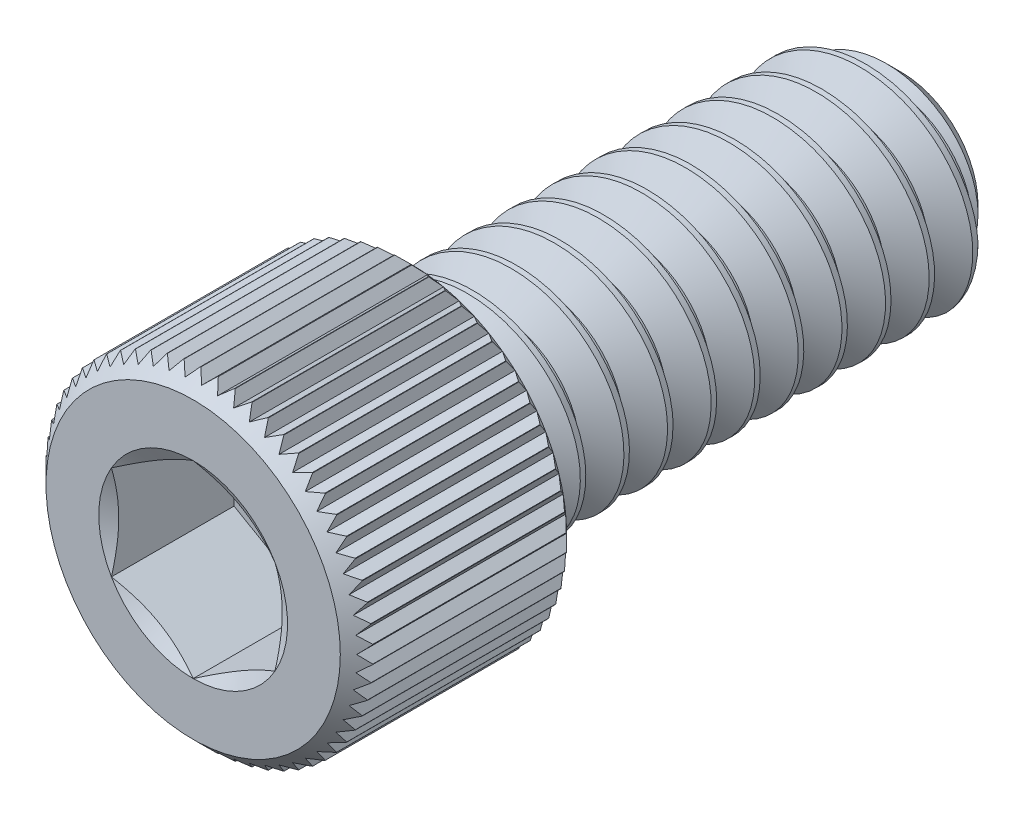
from build123d import *
from build123d.topology import SkipClean

# Parameters (mm, degrees)
CUT_EXTRUDE1_DEPTH = 3.571875
CHAMFER1_SIZE      = 0.47625
CHAMFER2_SIZE      = 0.238125
CUT_SWEEP1_PITCH   = 1.27
CUT_SWEEP1_TO      = 14.2875
CUT_EXTRUDE3_REACH = 17.795
CIRPATTERN1_COUNT  = 60


with BuildPart() as part:
    # Sketch2 → Revolve1 (revolve)
    with BuildSketch(Plane(origin=(0, 0, 0), x_dir=(0, 0, -1), z_dir=(1, 0, 0)), mode=Mode.PRIVATE) as revolve1_sk:
        Polygon((10.31875, 2.2225), (9.36625, 3.175), (-3.96875, 3.175), (-3.96875, 4.7625), (-10.31875, 4.7625), (-10.31875, 0), (10.31875, 0), align=None)
    revolve(revolve1_sk.sketch.rotate(Axis((0, 0, -10.31875), (0, 0, 1)), 90), axis=Axis((0, 0, -10.31875), (0, 0, 1)))

    # Sketch4 → Cut-Extrude1 (cut)
    with BuildSketch(Plane.XY.offset(10.31875)):
        Polygon((0, 2.749630657), (-2.38125, 1.374815329), (-2.38125, -1.374815329), (0, -2.749630657), (2.38125, -1.374815329), (2.38125, 1.374815329), align=None)
    extrude(amount=-CUT_EXTRUDE1_DEPTH, mode=Mode.SUBTRACT)

    # Cut-Extrude2 cone 1 section (through the dimple's axis) → Cut-Extrude2 (revolve, cut)
    with BuildSketch(Plane(origin=(0, 0, 10.31875), x_dir=(0, -1, 0), z_dir=(1, 0, 0))):
        Polygon((0, 0), (2.749630657, 0), (0, 1.5875), align=None)
    revolve(axis=Axis((0, 0, 10.31875), (0, 0, -1)), mode=Mode.SUBTRACT)

    # Chamfer1
    chamfer1_edges = [part.edges().sort_by_distance(p)[0] for p in [
        (4.7625, 0, 10.31875),
    ]]
    chamfer(chamfer1_edges, length=CHAMFER1_SIZE)

    # Chamfer2
    chamfer2_edges = [part.edges().sort_by_distance(p)[0] for p in [
        (4.7625, 0, 3.96875),
    ]]
    chamfer(chamfer2_edges, length=CHAMFER2_SIZE)


with BuildPart() as body_2:
    # Split1: read off the stored shape, not the designer's step
    # Split1: the piece on the far side of the plane
    add(part.part)
    split(bisect_by=Plane.XY.offset(3.96875), keep=Keep.BOTTOM)

    # Cut-Sweep1: arcs per turn and ends read off the stored shape
    # Cut-Sweep1: the profile of Sketch7 profile screwed along a right-hand helix through 12.25 turns, 8 arcs to a turn; built about Z, then put on its axis
    cut_sweep1_z = Axis((0, 0, 0), (0, 0, 1))
    cut_sweep1_corners = [(3.1753, 0, 0.000173205), (3.1753, 0, -1.111423205), (2.350110803, 0, -0.635), (2.350110803, 0, -0.47625)]
    with BuildLine(mode=Mode.PRIVATE) as cut_sweep1_profile:
        Line(cut_sweep1_corners[0], cut_sweep1_corners[1])
        Line(cut_sweep1_corners[1], cut_sweep1_corners[2])
        Line(cut_sweep1_corners[2], cut_sweep1_corners[3])
        Line(cut_sweep1_corners[3], cut_sweep1_corners[0])
    cut_sweep1_cap = Face(cut_sweep1_profile.wire())
    cut_sweep1_turn_angles = [0, 22.5, 45, 67.5, 90, 112.5, 135, 157.5, 180, 202.5, 225, 247.5, 270, 292.5, 315, 337.5, 360]
    cut_sweep1_turn_weights = [1, 0.9238795325112867, 1, 0.9238795325112867, 1, 0.9238795325112867, 1, 0.9238795325112867, 1, 0.9238795325112867, 1, 0.9238795325112867, 1, 0.9238795325112867, 1, 0.9238795325112867, 1]
    cut_sweep1_turn_rails = [Edge.make_bspline([Vector(p[0], p[1], 0).rotate(cut_sweep1_z, cut_sweep1_turn_angles[k]) / cut_sweep1_turn_weights[k] + Vector(0, 0, p[2] + CUT_SWEEP1_PITCH * cut_sweep1_turn_angles[k] / 360) for k in range(17)], [0, 0, 0, 1, 1, 2, 2, 3, 3, 4, 4, 5, 5, 6, 6, 7, 7, 8, 8, 8], 2, cut_sweep1_turn_weights) for p in cut_sweep1_corners]
    cut_sweep1_turn_sides = [Face.make_surface_from_curves(cut_sweep1_turn_rails[p[0]], cut_sweep1_turn_rails[p[1]]) for p in [(0, 1), (1, 2), (2, 3), (3, 0)]]
    cut_sweep1_last_angles = [4320, 4342.5, 4365, 4387.5, 4410]
    cut_sweep1_last_weights = [1, 0.9238795325112867, 1, 0.9238795325112199, 1]
    cut_sweep1_last_rails = [Edge.make_bspline([Vector(p[0], p[1], 0).rotate(cut_sweep1_z, cut_sweep1_last_angles[k]) / cut_sweep1_last_weights[k] + Vector(0, 0, p[2] + CUT_SWEEP1_PITCH * cut_sweep1_last_angles[k] / 360) for k in range(5)], [0, 0, 0, 1, 1, 2, 2, 2], 2, cut_sweep1_last_weights) for p in cut_sweep1_corners]
    cut_sweep1_last_sides = [Face.make_surface_from_curves(cut_sweep1_last_rails[p[0]], cut_sweep1_last_rails[p[1]]) for p in [(0, 1), (1, 2), (2, 3), (3, 0)]]
    cut_sweep1 = Plane(origin=(0, 0, -10.31875), x_dir=(0, 1, 0), z_dir=(0, 0, 1)) * split(Solid(Shell([*[p.moved(Location((0, 0, CUT_SWEEP1_PITCH * i))) for i in range(12) for p in cut_sweep1_turn_sides], *cut_sweep1_last_sides, cut_sweep1_cap, cut_sweep1_cap.rotate(cut_sweep1_z, 4410).moved(Location((0, 0, CUT_SWEEP1_PITCH * 4410 / 360)))])), bisect_by=Plane.XY.offset(CUT_SWEEP1_TO), keep=Keep.BOTTOM, mode=Mode.PRIVATE)
    add(cut_sweep1, mode=Mode.SUBTRACT)


with BuildPart() as part_1:
    add(part.part)

    # Split1
    split(bisect_by=Plane.XY.offset(3.96875), keep=Keep.TOP)

    add(body_2.part)  # Boss-Extrude4 merges body 2
    # Boss-Extrude4: read off the stored shape, not the designer's step
    # Boss-Extrude4 outline → Boss-Extrude4 (revolve)
    with BuildSketch(Plane.XZ):
        Polygon((2.350104501, 3.96875), (2.350104501, 3.143854501), (3.175, 3.96875), align=None)
    revolve(axis=Axis((0, 0, 0), (0, 0, 1)))

    # Cut-Extrude3: up to this cone (the profile starts inside it)
    with SkipClean():  # the faces are left unmerged after this step: merging them gives an invalid solid
        cut_extrude3_end = Plane(origin=(0, 0, 3.96875), z_dir=(0, 0, -1)).offset(-10.636249) * Cone(1e-06, 39.5675, 39.567499, align=(Align.CENTER, Align.CENTER, Align.MIN), mode=Mode.PRIVATE)
        # Sketch9 → Cut-Extrude3 (cut, up to the surface)
        with BuildSketch(Plane(origin=(0, 0, 3.96875), x_dir=(-1, 0, 0), z_dir=(0, 0, -1)), mode=Mode.PRIVATE) as cut_extrude3_sk1:
            Polygon((0, 4.524375), (-0.499184098, 5.000625), (0.499184098, 5.000625), align=None)
        cut_extrude3_tool1 = extrude(cut_extrude3_sk1.sketch, amount=-CUT_EXTRUDE3_REACH, mode=Mode.PRIVATE) & cut_extrude3_end
        cut_extrude3 = cut_extrude3_tool1.solids().sort_by_distance((0, 4.841875, 3.96875))[0]
        add(cut_extrude3, mode=Mode.SUBTRACT)

    # CirPattern1: Cut-Extrude3 ×60 about axis
    cirpattern1_axis = Axis((0, 0, 0), (0, 0, 1))
    for i in range(1, CIRPATTERN1_COUNT):
        add(cut_extrude3.rotate(cirpattern1_axis, i * 360 / CIRPATTERN1_COUNT), mode=Mode.SUBTRACT)


solid = part_1.part
